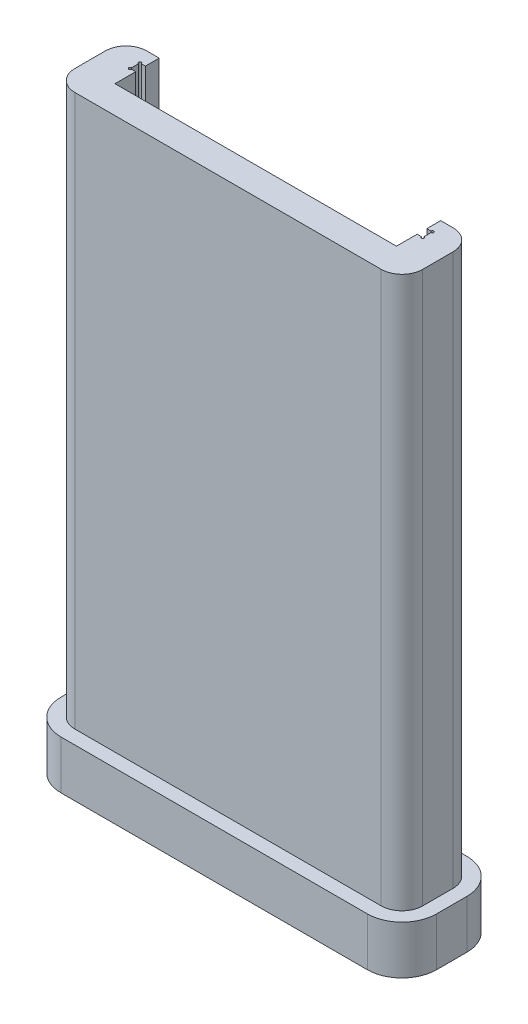
from build123d import *

# Parameters (mm, degrees)
SKETCH2_W               = 88.9
SKETCH2_H               = 152.4
BOSS_EXTRUDE1_DEPTH     = 5.9944
CUT_EXTRUDE2_DEPTH      = 177.535840076
CUT_EXTRUDE2_DEPTH_BACK = 177.535840076
SKETCH4_R               = 2.7305
BOSS_EXTRUDE2_DEPTH     = 101.6
FILLET1_R               = 3.81
CUT_EXTRUDE3_DEPTH      = 204.596488182
CUT_EXTRUDE3_DEPTH_BACK = 204.596488182
SKETCH7_W               = 2.54
SKETCH7_H               = 152.4
SKETCH11_W              = 86.36
SKETCH11_H              = 152.4
CUT_EXTRUDE4_DEPTH      = 6.35
BOSS_EXTRUDE3_DEPTH     = 8.89
SKETCH13_R              = 2.7305
CUT_EXTRUDE5_DEPTH      = 6.35


with BuildPart() as part:
    # Sketch2 → Boss-Extrude1 (new body)
    with BuildSketch(Plane(origin=(0, 0, 0), x_dir=(1, 0, 0), z_dir=(0, 1, 0))):
        with Locations((44.45, 76.2)):
            Rectangle(SKETCH2_W, SKETCH2_H)
    extrude(amount=BOSS_EXTRUDE1_DEPTH)

    # Sketch4 → Cut-Extrude2 (cut, two sides: drawn at the far end of the back side and taken through both)
    with BuildSketch(Plane(origin=(0, 5.9944, 0), x_dir=(1, 0, 0), z_dir=(0, 1, 0)).offset(-CUT_EXTRUDE2_DEPTH_BACK)):
        with Locations((45.72, 109.871331367)):
            Circle(SKETCH4_R)
        with Locations((45.72, 33.671331367)):
            Circle(SKETCH4_R)
    extrude(amount=CUT_EXTRUDE2_DEPTH + CUT_EXTRUDE2_DEPTH_BACK, mode=Mode.SUBTRACT)

    # Sketch5 → Boss-Extrude2 (add)
    with BuildSketch(Plane(origin=(0, 5.9944, 0), x_dir=(1, 0, 0), z_dir=(0, 1, 0))):
        with BuildLine():
            Line((18.6055, 15.748), (12.5095, 15.748))
            Line((12.5095, 15.748), (12.5095, 2.54))
            Line((12.5095, 2.54), (76.3905, 2.54))
            Line((76.3905, 2.54), (76.3905, 15.748))
            Line((76.3905, 15.748), (70.2945, 15.748))
            Line((70.2945, 15.748), (70.2945, 13.208))
            Line((70.2945, 13.208), (71.0565, 13.208))
            ThreePointArc((71.0565, 13.208), (71.3105, 13.462), (71.5645, 13.208))
            ThreePointArc((71.5645, 13.208), (71.490105122, 13.028394878), (71.3105, 12.954))
            Line((71.3105, 12.954), (71.3105, 11.684))
            ThreePointArc((71.3105, 11.684), (71.490105122, 11.609605122), (71.5645, 11.43))
            ThreePointArc((71.5645, 11.43), (71.3105, 11.176), (71.0565, 11.43))
            Line((71.0565, 11.43), (70.2945, 11.43))
            Line((70.2945, 11.43), (70.2945, 7.62))
            Line((70.2945, 7.62), (18.6055, 7.62))
            Line((18.6055, 7.62), (18.6055, 11.43))
            Line((18.6055, 11.43), (17.8435, 11.43))
            ThreePointArc((17.8435, 11.43), (17.409894878, 11.250394878), (17.5895, 11.684))
            Line((17.5895, 11.684), (17.5895, 12.954))
            ThreePointArc((17.5895, 12.954), (17.409894878, 13.387605122), (17.8435, 13.208))
            Line((17.8435, 13.208), (18.6055, 13.208))
            Line((18.6055, 13.208), (18.6055, 15.748))
        make_face()
    extrude(amount=BOSS_EXTRUDE2_DEPTH)

    # Fillet1
    fillet1_edges = [part.edges().sort_by_distance(p)[0] for p in [
        (12.5095, 56.7944, -2.54),
        (12.5095, 56.7944, -15.748),
        (76.3905, 56.7944, -2.54),
        (76.3905, 56.7944, -15.748),
    ]]
    fillet(fillet1_edges, radius=FILLET1_R)

    # Sketch7 → Cut-Extrude3 (cut, two sides: drawn at the far end of the back side and taken through both)
    with BuildSketch(Plane(origin=(0, 5.9944, 0), x_dir=(1, 0, 0), z_dir=(0, 1, 0)).offset(-CUT_EXTRUDE3_DEPTH_BACK)):
        with Locations((1.27, 76.2)):
            Rectangle(SKETCH7_W, SKETCH7_H)
    extrude(amount=CUT_EXTRUDE3_DEPTH + CUT_EXTRUDE3_DEPTH_BACK, mode=Mode.SUBTRACT)

    # Sketch11 → Cut-Extrude4 (cut)
    with BuildSketch(Plane.XZ):
        with Locations((45.72, -76.2)):
            Rectangle(SKETCH11_W, SKETCH11_H)
    extrude(amount=-CUT_EXTRUDE4_DEPTH, mode=Mode.SUBTRACT)

    # Sketch12 → Boss-Extrude3 (add)
    with BuildSketch(Plane.XZ.offset(-6.35)):
        with BuildLine():
            ThreePointArc((72.5805, -18.288), (77.070628061, -16.428128061), (78.9305, -11.938))
            Line((78.9305, -11.938), (78.9305, -6.35))
            ThreePointArc((78.9305, -6.35), (77.070628061, -1.859871939), (72.5805, 0))
            Line((72.5805, 0), (16.3195, 0))
            ThreePointArc((16.3195, 0), (11.829371939, -1.859871939), (9.9695, -6.35))
            Line((9.9695, -6.35), (9.9695, -11.938))
            ThreePointArc((9.9695, -11.938), (11.829371939, -16.428128061), (16.3195, -18.288))
            Line((16.3195, -18.288), (72.5805, -18.288))
        make_face()
    extrude(amount=BOSS_EXTRUDE3_DEPTH)

    # Sketch13 → Cut-Extrude5 (cut)
    with BuildSketch(Plane.XZ.offset(2.54)):
        with Locations((19.05, -9.144)):
            Circle(SKETCH13_R)
        with Locations((69.85, -9.144)):
            Circle(SKETCH13_R)
    extrude(amount=-CUT_EXTRUDE5_DEPTH, mode=Mode.SUBTRACT)


solid = part.part
